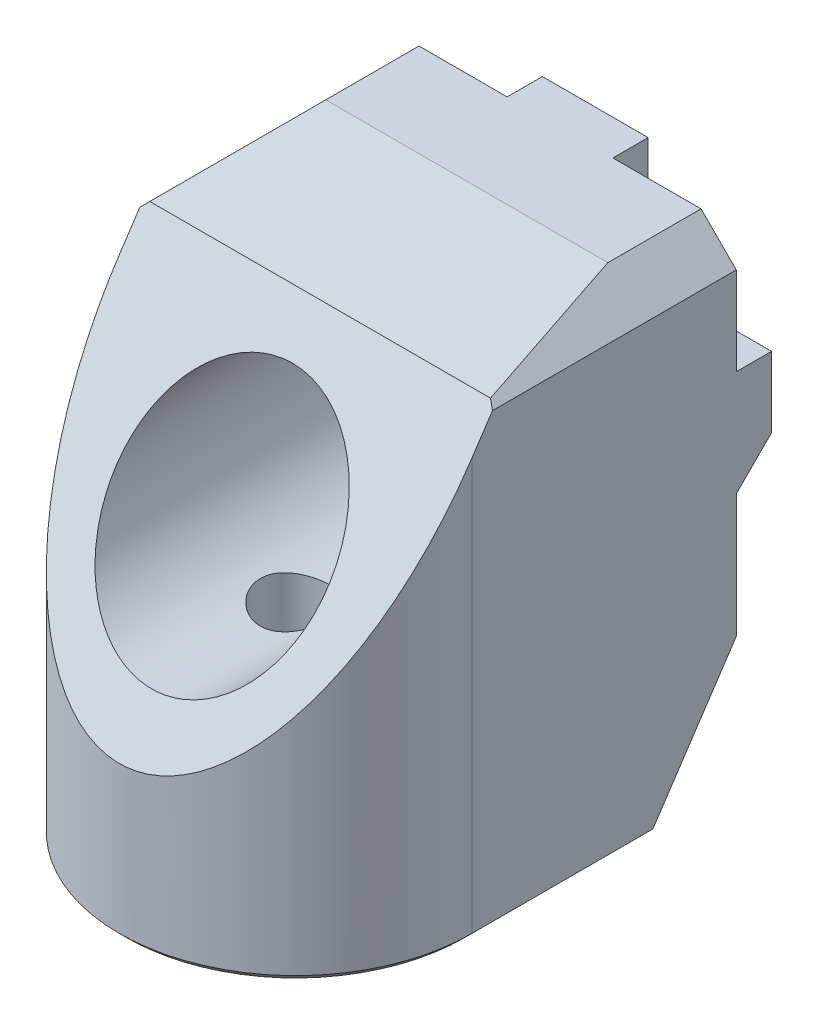
from build123d import *
from OCP.BRepFilletAPI import BRepFilletAPI_MakeChamfer

# Parameters (mm, degrees)
SKETCH1_R                = 2.75
BOSS_EXTRUDE1_DEPTH      = 25
CUT_EXTRUDE1_DEPTH       = 37.486298798
CUT_EXTRUDE1_DEPTH_BACK  = 37.486298798
CUT_EXTRUDE2_START       = -5
SKETCH3_R                = 6
CUT_EXTRUDE2_DEPTH       = 28.113081447
CUT_EXTRUDE3_START       = -23.75
CUT_EXTRUDE3_DEPTH       = 23.75
CUT_EXTRUDE3_START_2     = -14.426375
CUT_EXTRUDE3_2_OUTLINE_R = 2
CUT_EXTRUDE3_2_DEPTH     = 14.426375
CHAMFER1_SIZE            = 2
CHAMFER1_SIZE2           = 7.211102551
CHAMFER2_SIZE            = 0.4
SKETCH5_W                = 6
SKETCH5_H                = 4
SKETCH5_W_2              = 4
SKETCH5_H_2              = 6
BOSS_EXTRUDE2_DEPTH      = 2
CHAMFER3_SIZE            = 2


with BuildPart() as part:
    # Sketch1 → Boss-Extrude1 (new body)
    with BuildSketch(Plane.XY):
        Polygon((-10, 10), (10, 10), (10, -10), (10, -17.5), (-10, -17.5), (-10, -10), align=None)
        Circle(SKETCH1_R, mode=Mode.SUBTRACT)
    extrude(amount=BOSS_EXTRUDE1_DEPTH)

    # Sketch2 → Cut-Extrude1 (cut, two sides: drawn at the far end of the back side and taken through both)
    with BuildSketch(Plane(origin=(10, 0, 0), x_dir=(0, 0, -1), z_dir=(1, 0, 0)).offset(-CUT_EXTRUDE1_DEPTH_BACK)):
        Polygon((-5, -17.5), (0, -10), (0, -17.5), align=None)
        Polygon((-12.5, 10), (-25, -8.75), (-25, 10), align=None)
    extrude(amount=CUT_EXTRUDE1_DEPTH + CUT_EXTRUDE1_DEPTH_BACK, mode=Mode.SUBTRACT)

    # Sketch3 → Cut-Extrude2 (cut, through all)
    with BuildSketch(Plane(origin=(0, 0, 0), x_dir=(-1, 0, 0), z_dir=(0, 0, -1)).offset(CUT_EXTRUDE2_START)):
        Circle(SKETCH3_R)
    extrude(amount=-CUT_EXTRUDE2_DEPTH, mode=Mode.SUBTRACT)

    # Cut-Extrude3: read off the stored shape, not the designer's step
    # Cut-Extrude3 outline → Cut-Extrude3 (cut)
    with BuildSketch(Plane.XZ.offset(17.5).offset(CUT_EXTRUDE3_START)):
        with BuildLine():
            ThreePointArc((-10, 15), (-7.071067812, 22.071067812), (0, 25))
            Line((0, 25), (-10, 25))
            Line((-10, 25), (-10, 15))
        make_face()
        with BuildLine():
            ThreePointArc((0, 25), (7.071067812, 22.071067812), (10, 15))
            Line((10, 15), (10, 25))
            Line((10, 25), (0, 25))
        make_face()
    extrude(amount=CUT_EXTRUDE3_DEPTH, mode=Mode.SUBTRACT)

    # Cut-Extrude3 2 outline → Cut-Extrude3 2 (cut)
    with BuildSketch(Plane.XZ.offset(17.5).offset(CUT_EXTRUDE3_START_2)):
        with Locations((0, 15)):
            Circle(CUT_EXTRUDE3_2_OUTLINE_R)
    extrude(amount=CUT_EXTRUDE3_2_DEPTH, mode=Mode.SUBTRACT)

    # Chamfer1: one chamfer whose edges measure the first distance from different faces: ONE call of the kernel's chamfer builder (chamfer() names one face for all edges)
    chamfer1_edges_1 = [part.edges().sort_by_distance(p)[0] for p in [
        (-10, 10, 6.25),
        (10, 10, 6.25),
    ]]
    chamfer1_edges_2 = [part.edges().sort_by_distance(p)[0] for p in [
        (0, 10, 12.5),
    ]]
    chamfer1_side_2 = [part.faces().sort_by_distance(p)[0] for p in [
        (-9.69870073, 8.125, 13.75),
    ]]
    chamfer1 = BRepFilletAPI_MakeChamfer(part.part.solid().wrapped)
    for e in chamfer1_edges_1:
        chamfer1.Add(CHAMFER1_SIZE, e.wrapped)
    for e in chamfer1_edges_2:
        chamfer1.Add(CHAMFER1_SIZE, CHAMFER1_SIZE2, e.wrapped, chamfer1_side_2[0].wrapped)  # the first distance lies on this face
    add(Compound.cast(chamfer1.Shape()), mode=Mode.REPLACE)

    # Chamfer2
    chamfer2_edges = [part.edges().sort_by_distance(p)[0] for p in [
        (10, -17.5, 10),
        (-7.071067812, -17.5, 22.071067812),
        (-10, -17.5, 10),
    ]]
    chamfer(chamfer2_edges, length=CHAMFER2_SIZE)

    # Sketch5 → Boss-Extrude2 (add)
    with BuildSketch(Plane(origin=(0, 0, 0), x_dir=(-1, 0, 0), z_dir=(0, 0, -1))):
        with Locations((0, 8)):
            Rectangle(SKETCH5_W, SKETCH5_H)
        with Locations((8, 0)):
            Rectangle(SKETCH5_W_2, SKETCH5_H_2)
        with Locations((-8, 0)):
            Rectangle(SKETCH5_W_2, SKETCH5_H_2)
    extrude(amount=BOSS_EXTRUDE2_DEPTH)

    # Chamfer3
    chamfer3_edges = [part.edges().sort_by_distance(p)[0] for p in [
        (-8, -3, -2),
        (0, 6, -2),
        (8, -3, -2),
    ]]
    chamfer(chamfer3_edges, length=CHAMFER3_SIZE - 0.0001)  # a hair under: the kernel refuses the full size


solid = part.part
